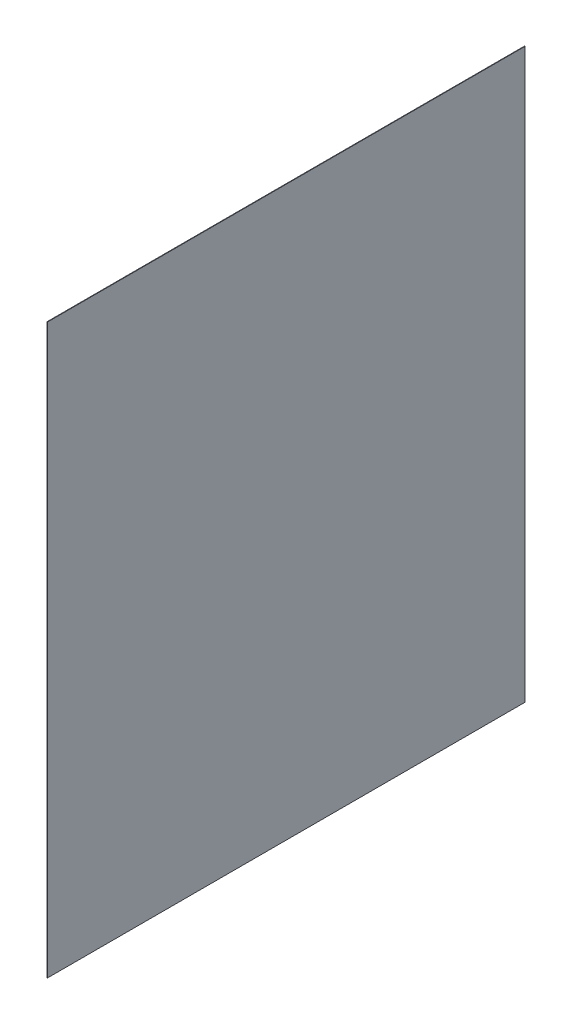
from build123d import *

# Parameters (mm, degrees)
SKETCH1_W          = 661.7
SKETCH1_H          = 787.05
BASE_FLANGE1_DEPTH = 0.7


# Sheet-metal steps are written as plain solids
with BuildPart() as part:
    # Sketch1 → Base-Flange1 (new body)
    with BuildSketch(Plane(origin=(0, 0, 0), x_dir=(0, 0, -1), z_dir=(1, 0, 0))):
        with Locations((330.85, 393.525)):
            Rectangle(SKETCH1_W, SKETCH1_H)
    extrude(amount=-BASE_FLANGE1_DEPTH)


solid = part.part
